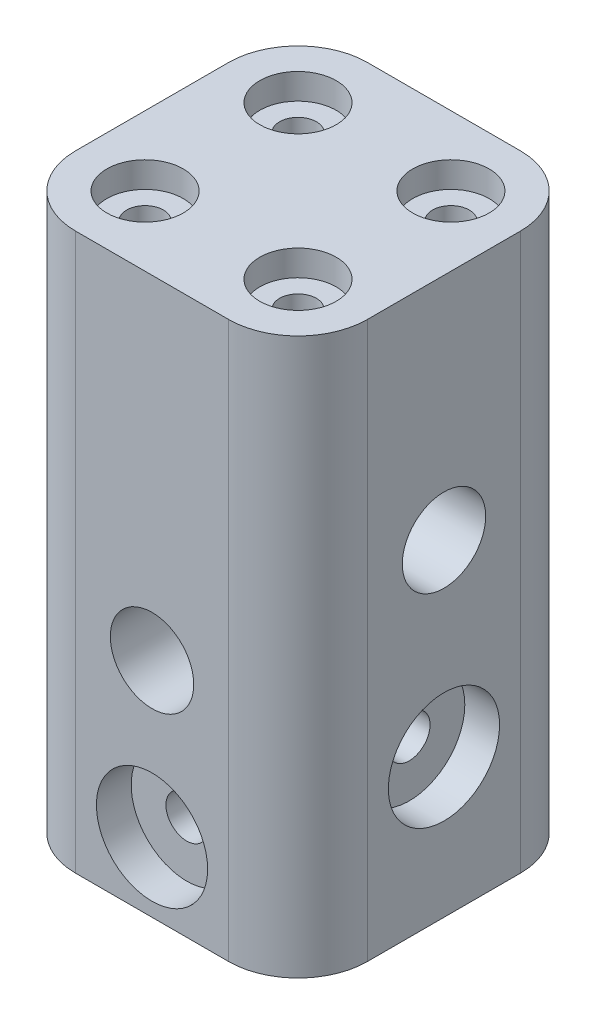
from build123d import *

# Parameters (mm, degrees)
SKETCH1_W                                        = 42
SKETCH1_H                                        = 42
BOSS_EXTRUDE1_DEPTH                              = 80
SKETCH2_R                                        = 6
CUT_EXTRUDE1_DEPTH                               = 93.763139231
SKETCH3_R                                        = 6
CUT_EXTRUDE2_DEPTH                               = 93.763139231
SKETCH4_R                                        = 3
CUT_EXTRUDE3_DEPTH                               = 93.763139231
SKETCH5_R                                        = 8
CUT_EXTRUDE4_DEPTH                               = 5
CUT_EXTRUDE5_START                               = -5
SKETCH6_R                                        = 8
CUT_EXTRUDE5_DEPTH                               = 5
SKETCH7_R                                        = 3
CUT_EXTRUDE6_DEPTH                               = 93.763139231
SKETCH8_R                                        = 8
CUT_EXTRUDE7_DEPTH                               = 5
CUT_EXTRUDE8_START                               = -5
SKETCH9_R                                        = 8
CUT_EXTRUDE8_DEPTH                               = 5
FILLET1_R                                        = 10
CBORE_FOR_M5_PAN_HEAD_MACHINE_SCREW1_D           = 5.3
CBORE_FOR_M5_PAN_HEAD_MACHINE_SCREW1_CBORE_D     = 11
CBORE_FOR_M5_PAN_HEAD_MACHINE_SCREW1_CBORE_DEPTH = 3.7


with BuildPart() as part:
    # Sketch1 → Boss-Extrude1 (new body)
    with BuildSketch(Plane(origin=(0, 0, 0), x_dir=(1, 0, 0), z_dir=(0, 1, 0))):
        Rectangle(SKETCH1_W, SKETCH1_H)
    extrude(amount=BOSS_EXTRUDE1_DEPTH)

    # Sketch2 → Cut-Extrude1 (cut, through all)
    with BuildSketch(Plane.XY.offset(21)):
        with Locations((0, 32)):
            Circle(SKETCH2_R)
    extrude(amount=-CUT_EXTRUDE1_DEPTH, mode=Mode.SUBTRACT)

    # Sketch3 → Cut-Extrude2 (cut, through all)
    with BuildSketch(Plane(origin=(21, 0, 0), x_dir=(0, 0, -1), z_dir=(1, 0, 0))):
        with Locations((0, 47)):
            Circle(SKETCH3_R)
    extrude(amount=-CUT_EXTRUDE2_DEPTH, mode=Mode.SUBTRACT)

    # Sketch4 → Cut-Extrude3 (cut, through all)
    with BuildSketch(Plane.XY.offset(21)):
        with Locations((0, 10)):
            Circle(SKETCH4_R)
    extrude(amount=-CUT_EXTRUDE3_DEPTH, mode=Mode.SUBTRACT)

    # Sketch5 → Cut-Extrude4 (cut)
    with BuildSketch(Plane.XY.offset(21)):
        with Locations((0, 10)):
            Circle(SKETCH5_R)
    extrude(amount=-CUT_EXTRUDE4_DEPTH, mode=Mode.SUBTRACT)

    # Sketch6 → Cut-Extrude5 (cut)
    with BuildSketch(Plane(origin=(0, 0, -21), x_dir=(-1, 0, 0), z_dir=(0, 0, -1)).offset(CUT_EXTRUDE5_START)):
        with Locations((0, 10)):
            Circle(SKETCH6_R)
    extrude(amount=CUT_EXTRUDE5_DEPTH, mode=Mode.SUBTRACT)

    # Sketch7 → Cut-Extrude6 (cut, through all)
    with BuildSketch(Plane(origin=(21, 0, 0), x_dir=(0, 0, -1), z_dir=(1, 0, 0))):
        with Locations((0, 20)):
            Circle(SKETCH7_R)
    extrude(amount=-CUT_EXTRUDE6_DEPTH, mode=Mode.SUBTRACT)

    # Sketch8 → Cut-Extrude7 (cut)
    with BuildSketch(Plane(origin=(21, 0, 0), x_dir=(0, 0, -1), z_dir=(1, 0, 0))):
        with Locations((0, 20)):
            Circle(SKETCH8_R)
    extrude(amount=-CUT_EXTRUDE7_DEPTH, mode=Mode.SUBTRACT)

    # Sketch9 → Cut-Extrude8 (cut)
    with BuildSketch(Plane.ZY.offset(21).offset(CUT_EXTRUDE8_START)):
        with Locations((0, 20)):
            Circle(SKETCH9_R)
    extrude(amount=CUT_EXTRUDE8_DEPTH, mode=Mode.SUBTRACT)

    # Fillet1
    fillet1_edges = [part.edges().sort_by_distance(p)[0] for p in [
        (21, 40, 21),
        (21, 40, -21),
        (-21, 40, 21),
        (-21, 40, -21),
    ]]
    fillet(fillet1_edges, radius=FILLET1_R)

    # CBORE for M5 Pan Head Machine Screw1 (through all)
    with Locations(Plane(origin=(0, 80, 0), x_dir=(1, 0, 0), z_dir=(0, 1, 0))):
        with Locations((-11, 11), (11, 11), (11, -11), (-11, -11)):
            CounterBoreHole(CBORE_FOR_M5_PAN_HEAD_MACHINE_SCREW1_D / 2, CBORE_FOR_M5_PAN_HEAD_MACHINE_SCREW1_CBORE_D / 2, CBORE_FOR_M5_PAN_HEAD_MACHINE_SCREW1_CBORE_DEPTH)


solid = part.part
